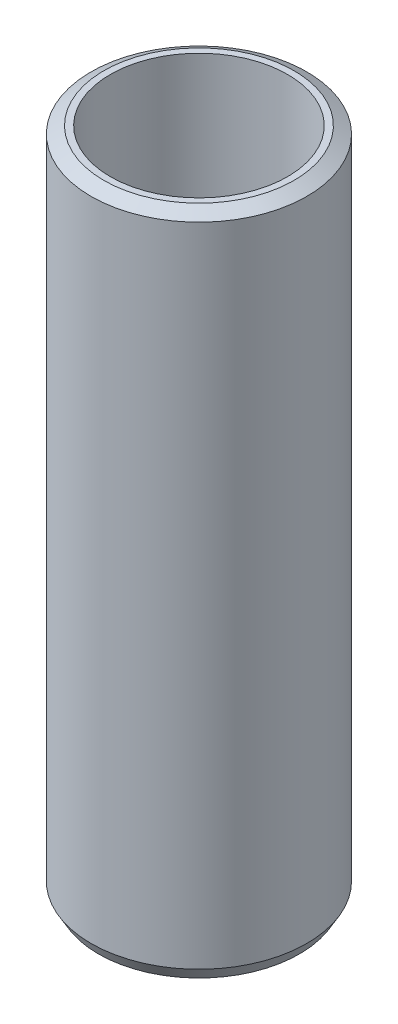
from build123d import *
from OCP.BRepFilletAPI import BRepFilletAPI_MakeChamfer

# Parameters (mm, degrees)
SKETCH1_R           = 45
BOSS_EXTRUDE1_DEPTH = 278.228435109
SKETCH2_R           = 36.956988606
CUT_EXTRUDE1_DEPTH  = 286.413843573
CHAMFER1_SIZE       = 3.087270185
CHAMFER1_SIZE2      = 5.347308818


with BuildPart() as part:
    # Sketch1 → Boss-Extrude1 (new body)
    with BuildSketch(Plane(origin=(0, 0, 0), x_dir=(1, 0, 0), z_dir=(0, 1, 0))):
        Circle(SKETCH1_R)
    extrude(amount=BOSS_EXTRUDE1_DEPTH)

    # Sketch2 → Cut-Extrude1 (cut, through all)
    with BuildSketch(Plane(origin=(0, 0, 0), x_dir=(1, 0, 0), z_dir=(0, 1, 0))):
        Circle(SKETCH2_R)
    extrude(amount=CUT_EXTRUDE1_DEPTH, mode=Mode.SUBTRACT)

    # Chamfer1: one chamfer whose edges measure the first distance from different faces: ONE call of the kernel's chamfer builder (chamfer() names one face for all edges)
    chamfer1_edges_1 = [part.edges().sort_by_distance(p)[0] for p in [
        (-45, 278.228435109, 0),
    ]]
    chamfer1_side_1 = [part.faces().sort_by_distance(p)[0] for p in [
        (-45, 139.114217555, 0),
    ]]
    chamfer1_edges_2 = [part.edges().sort_by_distance(p)[0] for p in [
        (-45, 0, 0),
    ]]
    chamfer1_side_2 = [part.faces().sort_by_distance(p)[0] for p in [
        (-43.727207794, 0, 0),
    ]]
    chamfer1 = BRepFilletAPI_MakeChamfer(part.part.solid().wrapped)
    for e in chamfer1_edges_1:
        chamfer1.Add(CHAMFER1_SIZE, CHAMFER1_SIZE2, e.wrapped, chamfer1_side_1[0].wrapped)  # the first distance lies on this face
    for e in chamfer1_edges_2:
        chamfer1.Add(CHAMFER1_SIZE, CHAMFER1_SIZE2, e.wrapped, chamfer1_side_2[0].wrapped)  # the first distance lies on this face
    add(Compound.cast(chamfer1.Shape()), mode=Mode.REPLACE)


solid = part.part
